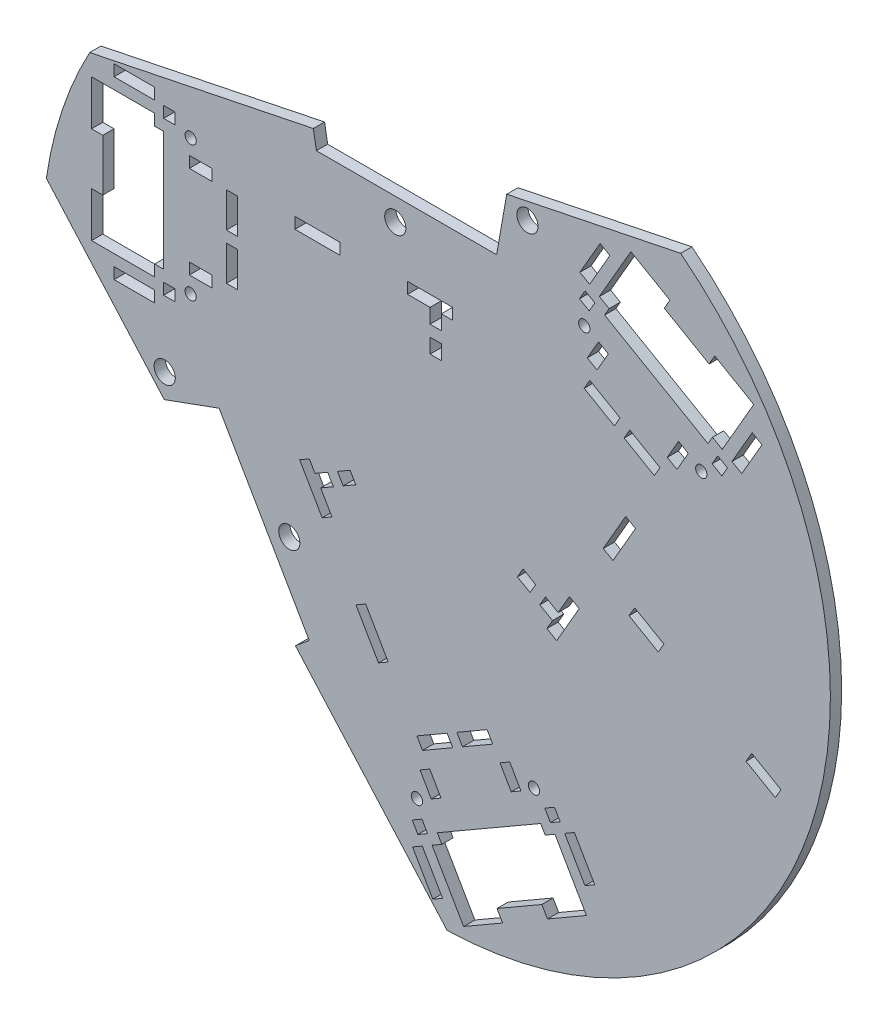
from build123d import *

# Parameters (mm, degrees)
ESQUISSE1_R             = 175
BOSS_EXTRU_1_DEPTH      = 5
ESQUISSE2_W             = 5
ESQUISSE2_H             = 6.5
ESQUISSE2_W_2           = 20
ESQUISSE2_H_2           = 5
ESQUISSE2_H_3           = 15.5
ESQUISSE2_W_3           = 10
ESQUISSE2_W_4           = 18
ESQUISSE2_H_4           = 20
ENL_V_MAT_EXTRU_1_DEPTH = 5
ENL_V_MAT_EXTRU_2_DEPTH = 5
ESQUISSE4_R             = 2.5
ENL_V_MAT_EXTRU_3_DEPTH = 5
ESQUISSE5_R             = 4.7
ENL_V_MAT_EXTRU_4_DEPTH = 5


with BuildPart() as part:
    # Esquisse1 → Boss.-Extru.1 (new body)
    with BuildSketch(Plane.XY):
        with Locations((148.080426897, -12.110171348)):
            Circle(ESQUISSE1_R)
    extrude(amount=BOSS_EXTRU_1_DEPTH)

    # Esquisse2 → Enlèv. mat.-Extru.1 (cut)
    with BuildSketch(Plane(origin=(0, 0, 0), x_dir=(-1, 0, 0), z_dir=(0, 0, -1))):
        Polygon((-155.311788567, 53.777441362), (-135.311788567, 53.777441362), (-135.311788567, 48.777441362), (-145.311788567, 48.777441362), (-145.311788567, 42.277441362), (-150.311788567, 42.277441362), (-150.311788567, 48.777441362), (-155.311788567, 48.777441362), align=None)
        with Locations((-147.811788567, 34.027441362)):
            Rectangle(ESQUISSE2_W, ESQUISSE2_H)
        with Locations((-95.311788567, 51.277441362)):
            Rectangle(ESQUISSE2_W_2, ESQUISSE2_H_2)
        with Locations((-57.36, 41.027441362)):
            Rectangle(ESQUISSE2_W, ESQUISSE2_H_3)
        with Locations((-57.36, 20.527441362)):
            Rectangle(ESQUISSE2_W, ESQUISSE2_H_3)
        with Locations((-43.43, 10.277441362)):
            Rectangle(ESQUISSE2_W_3, ESQUISSE2_H_2)
        with Locations((-29.5, -3.222558638)):
            Rectangle(ESQUISSE2_W, ESQUISSE2_H_2)
        with Locations((-14, -8.222558638)):
            Rectangle(ESQUISSE2_W_4, ESQUISSE2_H_2)
        with Locations((2.5, 9.277441362)):
            Rectangle(ESQUISSE2_W, ESQUISSE2_H_4)
        with Locations((2.5, 52.277441362)):
            Rectangle(ESQUISSE2_W, ESQUISSE2_H_4)
        with Locations((-14, 69.777441362)):
            Rectangle(ESQUISSE2_W_4, ESQUISSE2_H_2)
        with Locations((-29.5, 64.777441362)):
            Rectangle(ESQUISSE2_W, ESQUISSE2_H_2)
        with Locations((-43.43, 51.277441362)):
            Rectangle(ESQUISSE2_W_3, ESQUISSE2_H_2)
        Polygon((-87.404399659, -38.791434793), (-97.404399659, -56.111942869), (-101.734526678, -53.611942869), (-96.734526678, -44.951688831), (-102.363691803, -41.701688831), (-99.863691803, -37.371561812), (-94.234526678, -40.621561812), (-91.734526678, -36.291434793), align=None)
        Polygon((-104.193818822, -34.871561812), (-106.693818822, -39.201688831), (-112.322983946, -35.951688831), (-109.822983946, -31.621561812), align=None)
        Polygon((-112.404399659, -82.092704982), (-122.404399659, -99.413213058), (-126.734526678, -96.913213058), (-116.734526678, -79.592704982), align=None)
        Polygon((-139.460420962, -118.955108529), (-141.960420962, -123.285235548), (-155.38381472, -115.535235548), (-152.88381472, -111.205108529), align=None)
        Polygon((-157.213941739, -108.705108529), (-159.713941739, -113.035235548), (-173.137335498, -105.285235548), (-170.637335498, -100.955108529), align=None)
        Polygon((-176.352335498, -110.853778894), (-181.352335498, -119.514032932), (-185.682462517, -117.014032932), (-180.682462517, -108.353778894), align=None)
        Polygon((-196.258678449, -118.332576278), (-198.758678449, -122.662703297), (-203.088805468, -120.162703297), (-200.588805468, -115.832576278), align=None)
        Polygon((-205.088805468, -123.626804912), (-214.088805468, -139.215262181), (-218.418932487, -136.715262181), (-209.418932487, -121.126804912), align=None)
        Polygon((-212.258678449, -146.045389199), (-214.758678449, -150.375516218), (-197.438170373, -160.375516218), (-194.938170373, -156.045389199), align=None)
        Polygon((-175.019586086, -167.545389199), (-177.519586086, -171.875516218), (-160.199078011, -181.875516218), (-157.699078011, -177.545389199), align=None)
        Polygon((-141.868950992, -160.126804912), (-150.868950992, -175.715262181), (-146.538823973, -178.215262181), (-137.538823973, -162.626804912), align=None)
        Polygon((-139.868950992, -156.662703297), (-137.368950992, -152.332576278), (-141.699078011, -149.832576278), (-144.199078011, -154.162703297), align=None)
        Polygon((-145.845293943, -140.014032932), (-140.845293943, -131.353778894), (-145.175420962, -128.853778894), (-150.175420962, -137.514032932), align=None)
        Polygon((-201.525092463, -51.316520615), (-211.525092463, -33.996012539), (-207.194965444, -31.496012539), (-202.194965444, -40.156266577), (-196.56580032, -36.906266577), (-194.06580032, -41.236393596), (-199.694965444, -44.486393596), (-197.194965444, -48.816520615), align=None)
        Polygon((-189.735673301, -38.736393596), (-192.235673301, -34.406266577), (-186.606508176, -31.156266577), (-184.106508176, -35.486393596), align=None)
        Polygon((-226.525092463, -8.015250425), (-236.525092463, 9.30525765), (-232.194965444, 11.80525765), (-222.194965444, -5.515250425), align=None)
        Polygon((-244.920859728, 33.847153121), (-247.420859728, 38.17728014), (-233.997465969, 45.92728014), (-231.497465969, 41.597153121), align=None)
        Polygon((-227.16733895, 44.097153121), (-229.66733895, 48.42728014), (-216.243945192, 56.17728014), (-213.743945192, 51.847153121), align=None)
        Polygon((-219.458945192, 61.745823487), (-224.458945192, 70.406077524), (-220.128818173, 72.906077524), (-215.128818173, 64.245823487), align=None)
        Polygon((-215.982602241, 82.724620871), (-218.482602241, 87.05474789), (-214.152475222, 89.55474789), (-211.652475222, 85.224620871), align=None)
        Polygon((-216.152475222, 93.018849505), (-225.152475222, 108.607306773), (-220.822348203, 111.107306773), (-211.822348203, 95.518849505), align=None)
        Polygon((-231.982602241, 110.437433792), (-234.482602241, 114.767560811), (-251.803110316, 104.767560811), (-249.303110316, 100.437433792), align=None)
        Polygon((-269.221694603, 88.937433792), (-271.721694603, 93.267560811), (-289.042202679, 83.267560811), (-286.542202679, 78.937433792), align=None)
        Polygon((-279.372329698, 56.518849505), (-288.372329698, 72.107306773), (-292.702456717, 69.607306773), (-283.702456717, 54.018849505), align=None)
        Polygon((-277.372329698, 53.05474789), (-274.872329698, 48.724620871), (-270.542202679, 51.224620871), (-273.042202679, 55.55474789), align=None)
        Polygon((-259.965986747, 49.906077524), (-254.965986747, 41.245823487), (-250.635859728, 43.745823487), (-255.635859728, 52.406077524), align=None)
    extrude(amount=-ENL_V_MAT_EXTRU_1_DEPTH, mode=Mode.SUBTRACT)

    # Esquisse3 → Enlèv. mat.-Extru.2 (cut)
    with BuildSketch(Plane(origin=(0, 0, 0), x_dir=(-1, 0, 0), z_dir=(0, 0, -1))):
        Polygon((0, -0.722558638), (-23, -0.722558638), (-23, 4.277441362), (-27, 4.277441362), (-27, 57.277441362), (-23, 57.277441362), (-23, 62.277441362), (0, 62.277441362), align=None)
        Polygon((-212.258678449, -146.045389199), (-200.758678449, -126.126804912), (-196.42855143, -128.626804912), (-194.42855143, -125.162703297), (-148.52920503, -151.662703297), (-150.52920503, -155.126804912), (-146.199078011, -157.626804912), (-157.699078011, -177.545389199), align=None)
        Polygon((-231.982602241, 110.437433792), (-220.482602241, 90.518849505), (-224.81272926, 88.018849505), (-222.81272926, 84.55474789), (-268.71207566, 58.05474789), (-270.71207566, 61.518849505), (-275.042202679, 59.018849505), (-286.542202679, 78.937433792), align=None)
    extrude(amount=-ENL_V_MAT_EXTRU_2_DEPTH, mode=Mode.SUBTRACT)

    # Esquisse4 → Enlèv. mat.-Extru.3 (cut)
    with BuildSketch(Plane(origin=(0, 0, 0), x_dir=(-1, 0, 0), z_dir=(0, 0, -1))):
        with Locations((-39, 60.777441362)):
            Circle(ESQUISSE4_R)
        with Locations((-39, 0.777441362)):
            Circle(ESQUISSE4_R)
        with Locations((-139.498116116, -143.020398452)):
            Circle(ESQUISSE4_R)
        with Locations((-191.459640343, -113.020398452)):
            Circle(ESQUISSE4_R)
        with Locations((-265.743164573, 45.912443044)):
            Circle(ESQUISSE4_R)
        with Locations((-213.781640346, 75.912443044)):
            Circle(ESQUISSE4_R)
    extrude(amount=-ENL_V_MAT_EXTRU_3_DEPTH, mode=Mode.SUBTRACT)

    # Esquisse5 → Enlèv. mat.-Extru.4 (cut)
    with BuildSketch(Plane(origin=(0, 0, 0), x_dir=(-1, 0, 0), z_dir=(0, 0, -1))):
        with Locations((-188.54080573, 103.777441362)):
            Circle(ESQUISSE5_R)
        with Locations((-129.859999997, 73.777441362)):
            Circle(ESQUISSE5_R)
        with Locations((-27.488620889, -35.014261787)):
            Circle(ESQUISSE5_R)
        with Locations((-82.809785869, -70.833330267)):
            Circle(ESQUISSE5_R)
        Polygon((9.512961524, 70.443622585), (-93.474910733, 91.632672923), (-94.859999997, 83.777441362), (-174.859999997, 83.777441362), (-179.360865983, 109.303120805), (-315.699146075, 137.353789457), (-290.786999001, 258.437508623), (34.425108598, 191.527341751), align=None)
        Polygon((-233.671367804, -25.637538451), (-246.66174886, -33.137538451), (-249.16174886, -28.807411432), (-236.171367804, -21.307411432), align=None)
        Polygon((-155.383438382, -189.866946156), (-85.539246378, -111.271357669), (-91.649531831, -106.144219399), (-51.649531831, -36.862187096), (-27.293211991, -45.727162534), (65.168519701, 58.319917207), (157.574022946, -23.796494605), (-62.977935137, -271.983357968), align=None)
        Polygon((-285.632892031, -55.637538451), (-298.623273088, -63.137538451), (-301.123273088, -58.807411432), (-288.132892031, -51.307411432), align=None)
    extrude(amount=-ENL_V_MAT_EXTRU_4_DEPTH, mode=Mode.SUBTRACT)


solid = part.part
